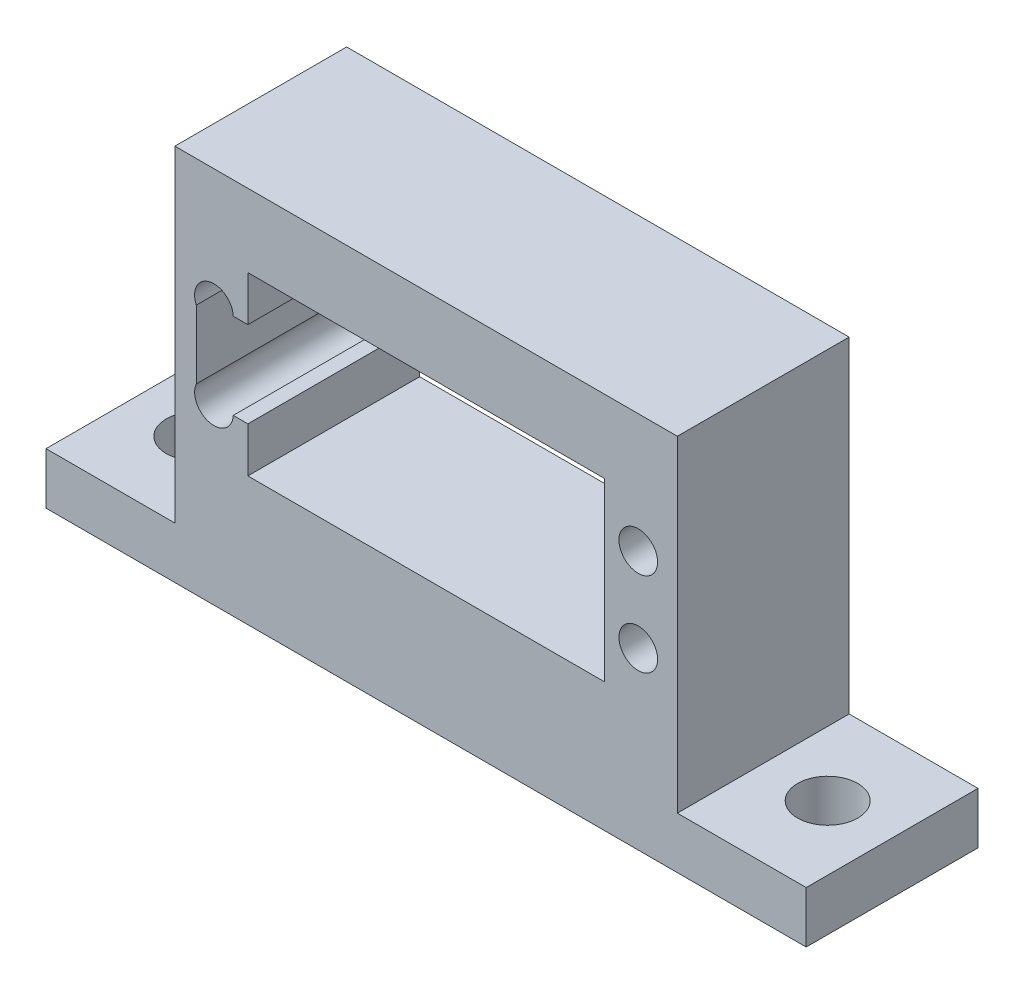
from build123d import *

# Parameters (mm, degrees)
SKETCH1_R           = 2.25
BOSS_EXTRUDE1_DEPTH = 20
SKETCH2_R           = 3.5
CUT_EXTRUDE1_DEPTH  = 62.660866844


with BuildPart() as part:
    # Sketch1 → Boss-Extrude1 (new body)
    with BuildSketch(Plane.XY):
        Polygon((-44.25, 0), (44.25, 0), (44.25, 6), (29.25, 6), (29.25, 44), (-29.25, 44), (-29.25, 6), (-44.25, 6), align=None)
        with Locations((24.7, 30.15)):
            Circle(SKETCH1_R, mode=Mode.SUBTRACT)
        with Locations((24.7, 20.35)):
            Circle(SKETCH1_R, mode=Mode.SUBTRACT)
        with BuildLine():
            Line((-20.75, 35.5), (20.75, 35.5))
            Line((20.75, 35.5), (20.75, 15))
            Line((20.75, 15), (-20.75, 15))
            Line((-20.75, 15), (-20.75, 20.25))
            Line((-20.75, 20.25), (-22.452223321, 20.25))
            ThreePointArc((-22.452223321, 20.25), (-25.223112795, 18.161655191), (-26.75, 21.27736185))
            Line((-26.75, 21.27736185), (-26.75, 29.22263815))
            ThreePointArc((-26.75, 29.22263815), (-25.223112795, 32.338344809), (-22.452223321, 30.25))
            Line((-22.452223321, 30.25), (-20.75, 30.25))
            Line((-20.75, 30.25), (-20.75, 35.5))
        make_face(mode=Mode.SUBTRACT)
    extrude(amount=BOSS_EXTRUDE1_DEPTH)

    # Sketch2 → Cut-Extrude1 (cut, through all)
    with BuildSketch(Plane(origin=(0, 6, 0), x_dir=(1, 0, 0), z_dir=(0, 1, 0))):
        with Locations((36.75, -10)):
            Circle(SKETCH2_R)
        with Locations((-36.75, -10)):
            Circle(SKETCH2_R)
    extrude(amount=-CUT_EXTRUDE1_DEPTH, mode=Mode.SUBTRACT)


solid = part.part
